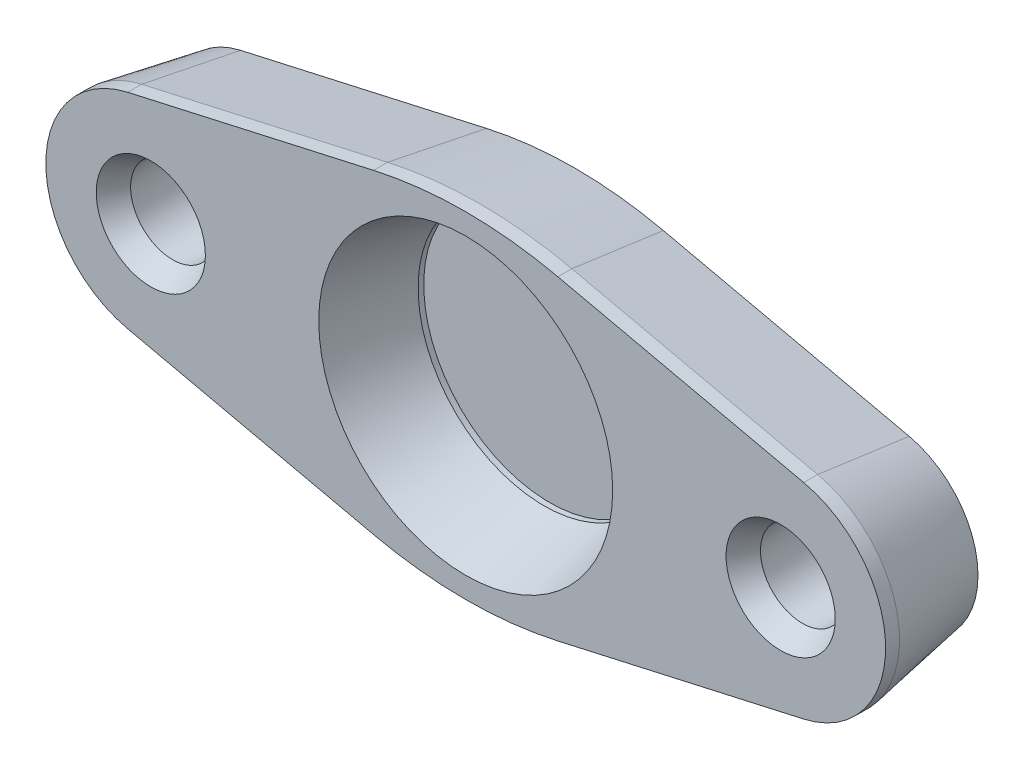
from build123d import *

# Parameters (mm, degrees)
SKETCH1_R           = 1
BOSS_EXTRUDE1_DEPTH = 2.6
SKETCH2_R           = 3
CUT_EXTRUDE1_DEPTH  = 2
CHAMFER1_SIZE       = 0.4
CHAMFER1_SIZE2      = 2.268512728
CHAMFER2_SIZE       = 0.5
CHAMFER2_SIZE2      = 1.866025404
CHAMFER3_SIZE       = 0.3
CHAMFER3_SIZE2      = 0.519615242


with BuildPart() as part:
    # Sketch1 → Boss-Extrude1 (new body)
    with BuildSketch(Plane.XY):
        with BuildLine():
            Line((-8.048780488, 2.43902439), (-2.195121951, 3.756097561))
            ThreePointArc((-2.195121951, 3.756097561), (0, 4), (2.195121951, 3.756097561))
            Line((2.195121951, 3.756097561), (8.048780488, 2.43902439))
            ThreePointArc((8.048780488, 2.43902439), (10, 0), (8.048780488, -2.43902439))
            Line((8.048780488, -2.43902439), (2.195121951, -3.756097561))
            ThreePointArc((2.195121951, -3.756097561), (0, -4), (-2.195121951, -3.756097561))
            Line((-2.195121951, -3.756097561), (-8.048780488, -2.43902439))
            ThreePointArc((-8.048780488, -2.43902439), (-10, 0), (-8.048780488, 2.43902439))
        make_face()
        with Locations((7.5, 0)):
            Circle(SKETCH1_R, mode=Mode.SUBTRACT)
        with Locations((-7.5, 0)):
            Circle(SKETCH1_R, mode=Mode.SUBTRACT)
    extrude(amount=BOSS_EXTRUDE1_DEPTH)

    # Sketch2 → Cut-Extrude1 (cut)
    with BuildSketch(Plane.XY.offset(2.6)):
        Circle(SKETCH2_R)
    extrude(amount=-CUT_EXTRUDE1_DEPTH, mode=Mode.SUBTRACT)

    # Chamfer1
    chamfer1_edges = [part.edges().sort_by_distance(p)[0] for p in [
        (-5.12195122, 3.097560976, 0),
        (-10, 0, 0),
        (0, 4, 0),
        (-5.12195122, -3.097560976, 0),
        (5.12195122, 3.097560976, 0),
        (0, -4, 0),
        (10, 0, 0),
        (5.12195122, -3.097560976, 0),
    ]]
    chamfer1_side = [part.faces().sort_by_distance(p)[0] for p in [
        (0, 0, 0),
    ]]
    chamfer(chamfer1_edges, length=CHAMFER1_SIZE, length2=CHAMFER1_SIZE2, reference=chamfer1_side[0])

    # Chamfer2
    chamfer2_edges = [part.edges().sort_by_distance(p)[0] for p in [
        (-3, 0, 2.6),
    ]]
    chamfer2_side = [part.faces().sort_by_distance(p)[0] for p in [
        (-5.074666846, 2.887408203, 2.6),
    ]]
    chamfer(chamfer2_edges, length=CHAMFER2_SIZE, length2=CHAMFER2_SIZE2, reference=chamfer2_side[0])

    # Chamfer3
    chamfer3_edges = [part.edges().sort_by_distance(p)[0] for p in [
        (6.5, 0, 2.6),
        (-8.5, 0, 2.6),
    ]]
    chamfer3_side = [part.faces().sort_by_distance(p)[0] for p in [
        (-3.715406592, 0, 2.6),
    ]]
    chamfer(chamfer3_edges, length=CHAMFER3_SIZE, length2=CHAMFER3_SIZE2, reference=chamfer3_side[0])


solid = part.part
